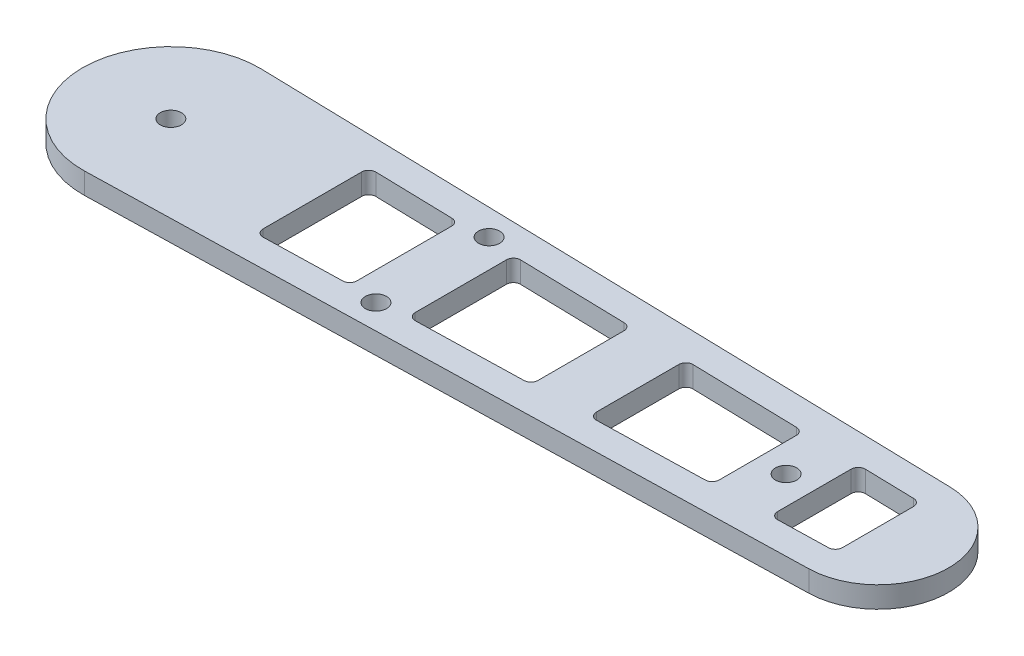
from build123d import *

# Parameters (mm, degrees)
SKETCH_1_R          = 1.5
EXTRUDE_1_DEPTH     = 3
SKETCH_2_R          = 4.5
SKETCH_2_R_2        = 3
EXTRUDE_2_DEPTH     = 2.5
SKETCH_3_R          = 1.5
CUT_EXTRUDE_1_DEPTH = 3
FILLET_1_R          = 1
SKETCH_4_R          = 3
SKETCH_4_R_2        = 1.5
EXTRUDE_3_DEPTH     = 1


with BuildPart() as part:
    # 草图1 → 凸台-拉伸1 (new body)
    with BuildSketch(Plane(origin=(0, 0, 0), x_dir=(1, 0, 0), z_dir=(0, 1, 0))):
        with BuildLine():
            ThreePointArc((0.3125, 12.496093139), (-12.5, 0), (0.3125, -12.496093139))
            Line((0.3125, -12.496093139), (100.25, -9.996874512))
            ThreePointArc((100.25, -9.996874512), (110, 0), (100.25, 9.996874512))
            Line((100.25, 9.996874512), (0.3125, 12.496093139))
        make_face()
        Circle(SKETCH_1_R, mode=Mode.SUBTRACT)
    extrude(amount=EXTRUDE_1_DEPTH)

    # 草图2 → 凸台-拉伸2 (add)
    with BuildSketch(Plane.XZ):
        Circle(SKETCH_2_R)
        Circle(SKETCH_2_R_2, mode=Mode.SUBTRACT)
    extrude(amount=EXTRUDE_2_DEPTH)

    # 草图3 → 切除-拉伸1 (cut)
    with BuildSketch(Plane(origin=(0, 3, 0), x_dir=(1, 0, 0), z_dir=(0, 1, 0))):
        Polygon((20, 8.002501172), (20, -8.002501172), (33, -7.677399562), (33, 7.677399562), align=None)
        Polygon((41, 7.477337033), (41, -7.477337033), (58, -7.052204158), (58, 7.052204158), align=None)
        with Locations((37, 8)):
            Circle(SKETCH_3_R)
        with Locations((37, -8)):
            Circle(SKETCH_3_R)
        Polygon((66, 6.852141629), (66, -6.852141629), (83, -6.427008754), (83, 6.427008754), align=None)
        with Locations((87, 0)):
            Circle(SKETCH_3_R)
        Polygon((100, 6.001875879), (91, 6.226946225), (91, -6.226946225), (100, -6.001875879), align=None)
    extrude(amount=-CUT_EXTRUDE_1_DEPTH, mode=Mode.SUBTRACT)

    # 圆角1
    fillet_1_edges = [part.edges().sort_by_distance(p)[0] for p in [
        (91, 1.5, -6.226946225),
        (91, 1.5, 6.226946225),
        (100, 1.5, 6.001875879),
        (100, 1.5, -6.001875879),
        (83, 1.5, -6.427008754),
        (66, 1.5, -6.852141629),
        (66, 1.5, 6.852141629),
        (83, 1.5, 6.427008754),
        (58, 1.5, 7.052204158),
        (41, 1.5, 7.477337033),
        (58, 1.5, -7.052204158),
        (41, 1.5, -7.477337033),
        (33, 1.5, 7.677399562),
        (33, 1.5, -7.677399562),
        (20, 1.5, 8.002501172),
        (20, 1.5, -8.002501172),
    ]]
    fillet(fillet_1_edges, radius=FILLET_1_R)

    # 草图4 → 凸台-拉伸3 (add)
    with BuildSketch(Plane.XZ):
        Circle(SKETCH_4_R)
        Circle(SKETCH_4_R_2, mode=Mode.SUBTRACT)
    extrude(amount=EXTRUDE_3_DEPTH)


solid = part.part
